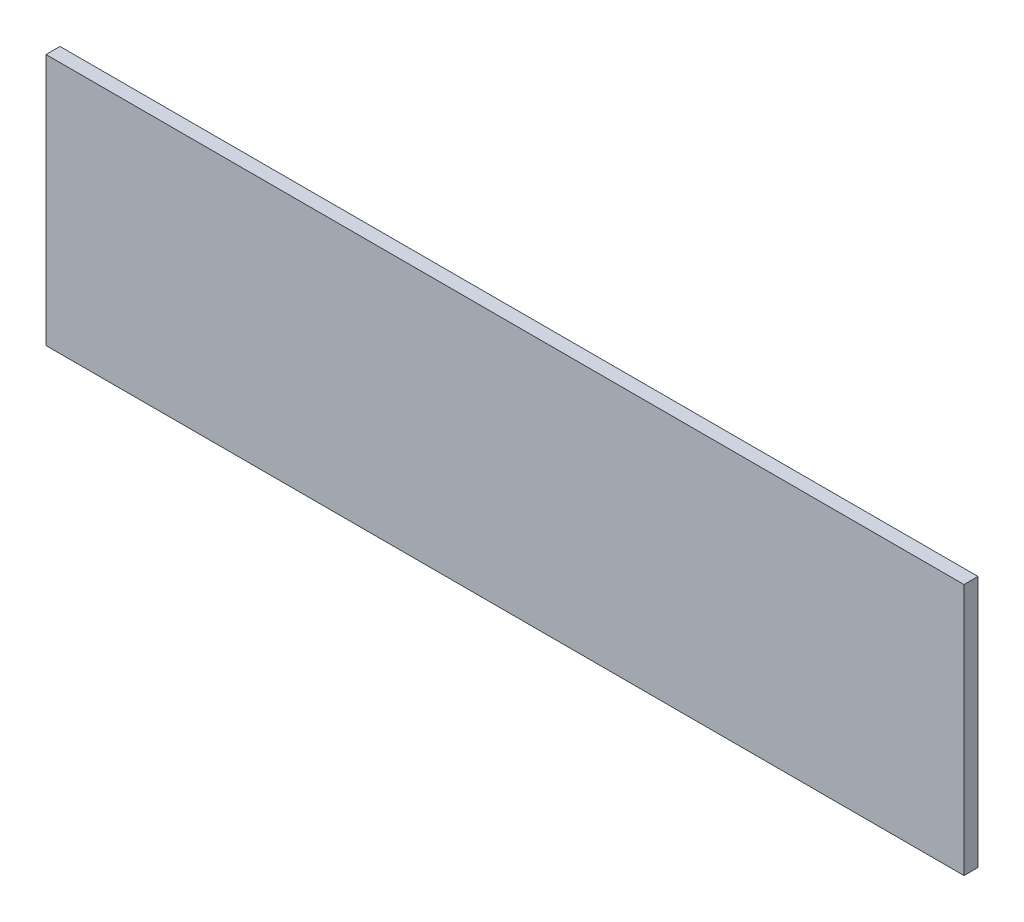
from build123d import *

# Parameters (mm, degrees)
SKETCH1_W           = 295
SKETCH1_H           = 81
BOSS_EXTRUDE1_DEPTH = 4.5


with BuildPart() as part:
    # Sketch1 → Boss-Extrude1 (new body)
    with BuildSketch(Plane.XY):
        Rectangle(SKETCH1_W, SKETCH1_H)
    extrude(amount=BOSS_EXTRUDE1_DEPTH)


solid = part.part
